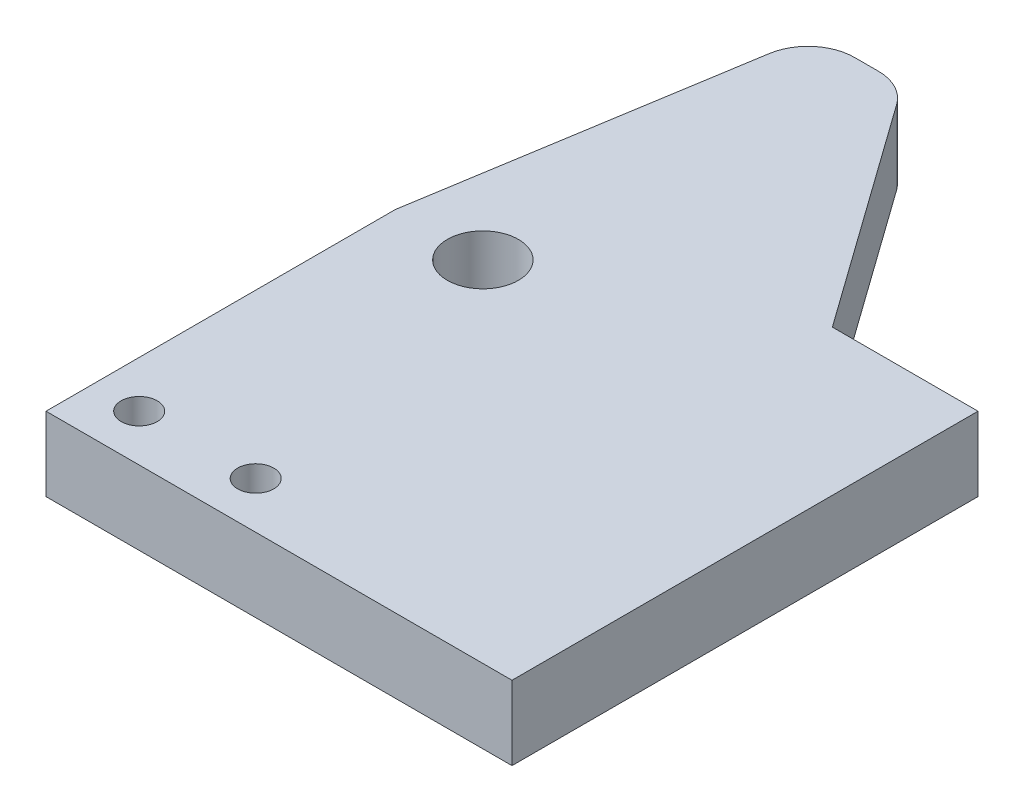
from build123d import *

# Parameters (mm, degrees)
SKETCH1_R           = 6.1
SKETCH1_R_2         = 3.1
BOSS_EXTRUDE1_DEPTH = 12.7


with BuildPart() as part:
    # Sketch1 → Boss-Extrude1 (new body)
    with BuildSketch(Plane(origin=(0, 0, 0), x_dir=(1, 0, 0), z_dir=(0, 1, 0))):
        with BuildLine():
            Line((0, 0), (-80, 0))
            Line((-80, 0), (-80, 60))
            Line((-80, 60), (-71.084861369, 115.273859511))
            ThreePointArc((-71.084861369, 115.273859511), (-68.373893167, 120.090602437), (-63.186932404, 122))
            Line((-63.186932404, 122), (-59.116943162, 122))
            ThreePointArc((-59.116943162, 122), (-55.456290515, 121.113341142), (-52.607075393, 118.64990555))
            Line((-52.607075393, 118.64990555), (-25, 80))
            Line((-25, 80), (0, 80))
            Line((0, 80), (0, 0))
        make_face()
        with Locations((-65, 60)):
            Circle(SKETCH1_R, mode=Mode.SUBTRACT)
        with Locations((-72, 8)):
            Circle(SKETCH1_R_2, mode=Mode.SUBTRACT)
        with Locations((-52, 8)):
            Circle(SKETCH1_R_2, mode=Mode.SUBTRACT)
    extrude(amount=BOSS_EXTRUDE1_DEPTH)


solid = part.part
